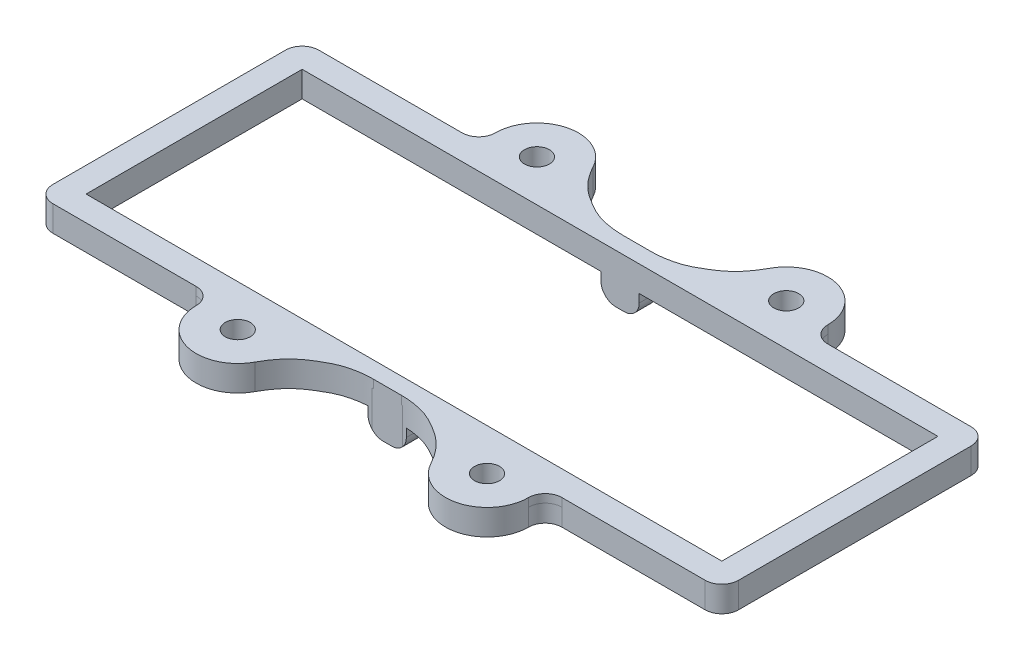
from build123d import *
from build123d.topology import SkipClean

# Parameters (mm, degrees)
SKETCH1_W           = 40
SKETCH1_H           = 7
SKETCH1_R           = 1.5
SKETCH1_W_2         = 82.5
SKETCH1_H_2         = 32
SKETCH1_W_3         = 76.5
SKETCH1_H_3         = 26
BOSS_EXTRUDE1_DEPTH = 2.085
SKETCH2_W           = 5
SKETCH2_H           = 10
BOSS_EXTRUDE2_DEPTH = 3
FILLET1_R           = 2
FILLET2_R           = 2
CUT_EXTRUDE1_DEPTH  = 65.136818612
SKETCH4_W           = 30
SKETCH4_H           = 6.817038716
CUT_EXTRUDE2_DEPTH  = 53.089568977
FILLET3_R           = 5
FILLET4_R           = 2
BOSS_EXTRUDE3_START = 1
SKETCH5_R           = 1.5
BOSS_EXTRUDE3_DEPTH = 1
FILLET5_START       = 2.085
FILLET5_DEPTH       = 1


with BuildPart() as part:
    # Sketch1 → Boss-Extrude1 (new body)
    # profile 1 of 3: a face of its own
    with BuildSketch(Plane(origin=(0, 0, 0), x_dir=(1, 0, 0), z_dir=(0, 1, 0))):
        with Locations((-3.342953498, -16.024946279)):
            Rectangle(SKETCH1_W, SKETCH1_H)
        with Locations(Location((-18.342953498, -14.524946279, 0), (0, 0, 270))):
            Circle(SKETCH1_R, mode=Mode.SUBTRACT)
        with Locations(Location((11.657046502, -14.524946279, 0), (0, 0, 270))):
            Circle(SKETCH1_R, mode=Mode.SUBTRACT)
    # profile 2 of 3: a face of its own
    with BuildSketch(Plane(origin=(0, 0, 0), x_dir=(1, 0, 0), z_dir=(0, 1, 0))):
        with Locations((-3.342953498, 3.475053721)):
            Rectangle(SKETCH1_W_2, SKETCH1_H_2)
        with Locations((-3.342953498, 3.475053721)):
            Rectangle(SKETCH1_W_3, SKETCH1_H_3, mode=Mode.SUBTRACT)
    # profile 3 of 3: a face of its own
    with BuildSketch(Plane(origin=(0, 0, 0), x_dir=(1, 0, 0), z_dir=(0, 1, 0))):
        with Locations((-3.342953498, 22.975053721)):
            Rectangle(SKETCH1_W, SKETCH1_H)
        with Locations(Location((-18.342953498, 21.475053721, 0), (0, 0, 270))):
            Circle(SKETCH1_R, mode=Mode.SUBTRACT)
        with Locations(Location((11.657046502, 21.475053721, 0), (0, 0, 270))):
            Circle(SKETCH1_R, mode=Mode.SUBTRACT)
    extrude(amount=BOSS_EXTRUDE1_DEPTH)

    # Sketch2 → Boss-Extrude2 (add)
    with BuildSketch(Plane.XZ):
        with Locations((-3.342953498, 14.524946279)):
            Rectangle(SKETCH2_W, SKETCH2_H)
        with Locations((-3.342953498, -21.475053721)):
            Rectangle(SKETCH2_W, SKETCH2_H)
    extrude(amount=BOSS_EXTRUDE2_DEPTH)

    # Fillet1
    fillet1_edges = [part.edges().sort_by_distance(p)[0] for p in [
        (-5.842953498, -3, 14.524946279),
        (-0.842953498, -3, 14.524946279),
        (-0.842953498, -3, -21.475053721),
        (-5.842953498, -3, -21.475053721),
    ]]
    fillet(fillet1_edges, radius=FILLET1_R)

    # Fillet2
    fillet2_edges = [part.edges().sort_by_distance(p)[0] for p in [
        (-44.592953498, 1.0425, 12.524946279),
        (-44.592953498, 1.0425, -19.475053721),
        (37.907046502, 1.0425, -19.475053721),
        (37.907046502, 1.0425, 12.524946279),
    ]]
    fillet(fillet2_edges, radius=FILLET2_R)

    # Sketch3 → Cut-Extrude1 (cut, through all)
    with BuildSketch(Plane(origin=(0, 0, -26.475053721), x_dir=(-1, 0, 0), z_dir=(0, 0, -1))):
        with BuildLine():
            Line((5.842953498, -1), (5.842953498, 0))
            Line((5.842953498, 0), (5.642953498, 0))
            Line((5.642953498, 0), (5.642953498, -1))
            ThreePointArc((5.642953498, -1), (5.115745704, -2.272792206), (3.842953498, -2.8))
            Line((3.842953498, -2.8), (2.842953498, -2.8))
            ThreePointArc((2.842953498, -2.8), (1.570161291, -2.272792206), (1.042953498, -1))
            Line((1.042953498, -1), (1.042953498, 0))
            Line((1.042953498, 0), (0.842953498, 0))
            Line((0.842953498, 0), (0.842953498, -1))
            ThreePointArc((0.842953498, -1), (1.428739935, -2.414213562), (2.842953498, -3))
            Line((2.842953498, -3), (3.842953498, -3))
            ThreePointArc((3.842953498, -3), (5.25716706, -2.414213562), (5.842953498, -1))
        make_face()
    extrude(amount=-CUT_EXTRUDE1_DEPTH, mode=Mode.SUBTRACT)

    # Sketch4 → Cut-Extrude2 (cut, through all)
    with BuildSketch(Plane(origin=(0, 2.085, 0), x_dir=(1, 0, 0), z_dir=(0, 1, 0))):
        with BuildLine():
            Line((-5.025587433, 18.475053721), (-3.342953498, 18.475053721))
            Line((-3.342953498, 18.475053721), (-1.660319563, 18.475053721))
            Line((-1.660319563, 18.475053721), (-1.5063675, 18.475053721))
            add(Edge.make_bspline(
                [(7.234880115, 23.808387054), (6.697838422, 22.80689338), (5.54618786, 21.222701251), (3.456402004, 19.887657692), (1.890908212, 19.048171258), (0.265447838, 18.611656881), (-0.841891354, 18.480685845), (-1.5063675, 18.475053721)],
                knots=[0, 0, 0, 0, 0.31493804, 0.524439854, 0.679221784, 0.802825172, 0.985869019, 0.985869019, 0.985869019, 0.985869019], degree=3))
            ThreePointArc((7.234880115, 23.808387054), (9.075057605, 25.756797914), (11.657046502, 26.475053721))
            Line((11.657046502, 26.475053721), (-18.342953498, 26.475053721))
            ThreePointArc((-18.342953498, 26.475053721), (-15.7609646, 25.756797914), (-13.92078711, 23.808387054))
            add(Edge.make_bspline(
                [(-13.92078711, 23.808387054), (-13.383745417, 22.80689338), (-12.232094855, 21.222701251), (-10.142308999, 19.887657692), (-8.576815207, 19.048171258), (-6.951354833, 18.611656881), (-5.844015641, 18.480685845), (-5.179539495, 18.475053721)],
                knots=[0, 0, 0, 0, 0.31493804, 0.524439854, 0.679221784, 0.802825172, 0.985869019, 0.985869019, 0.985869019, 0.985869019], degree=3))
            Line((-5.179539495, 18.475053721), (-5.025587433, 18.475053721))
        make_face()
        with Locations((-3.342953498, 29.883573079)):
            Rectangle(SKETCH4_W, SKETCH4_H)
        with BuildLine():
            ThreePointArc((-13.92078711, -16.858279612), (-15.7609646, -18.806690472), (-18.342953498, -19.524946279))
            Line((-18.342953498, -19.524946279), (11.657046502, -19.524946279))
            ThreePointArc((11.657046502, -19.524946279), (9.075057605, -18.806690472), (7.234880115, -16.858279612))
            add(Edge.make_bspline(
                [(7.234880115, -16.858279612), (6.697838422, -15.856785937), (5.54618786, -14.272593809), (3.456402004, -12.937550249), (1.890908212, -12.098063816), (0.265447838, -11.661549439), (-0.841891354, -11.530578403), (-1.5063675, -11.524946279)],
                knots=[0, 0, 0, 0, 0.31493804, 0.524439854, 0.679221784, 0.802825172, 0.985869019, 0.985869019, 0.985869019, 0.985869019], degree=3))
            Line((-1.5063675, -11.524946279), (-1.660319563, -11.524946279))
            Line((-1.660319563, -11.524946279), (-3.342953498, -11.524946279))
            Line((-3.342953498, -11.524946279), (-5.025587433, -11.524946279))
            Line((-5.025587433, -11.524946279), (-5.179539495, -11.524946279))
            add(Edge.make_bspline(
                [(-13.92078711, -16.858279612), (-13.383745417, -15.856785937), (-12.232094855, -14.272593809), (-10.142308999, -12.937550249), (-8.576815207, -12.098063816), (-6.951354833, -11.661549439), (-5.844015641, -11.530578403), (-5.179539495, -11.524946279)],
                knots=[0, 0, 0, 0, 0.31493804, 0.524439854, 0.679221784, 0.802825172, 0.985869019, 0.985869019, 0.985869019, 0.985869019], degree=3))
        make_face()
        with Locations((-3.342953498, -22.933465637)):
            Rectangle(SKETCH4_W, SKETCH4_H)
    extrude(amount=-CUT_EXTRUDE2_DEPTH, mode=Mode.SUBTRACT)

    # Fillet3
    fillet3_edges = [part.edges().sort_by_distance(p)[0] for p in [
        (16.657046502, 1.0425, -26.475053721),
        (-23.342953498, 1.0425, -26.475053721),
        (-23.342953498, 1.0425, 19.524946279),
        (16.657046502, 1.0425, 19.524946279),
    ]]
    fillet(fillet3_edges, radius=FILLET3_R - 0.0001)  # a hair under: the kernel refuses the full size

    # Fillet4
    fillet4_edges = [part.edges().sort_by_distance(p)[0] for p in [
        (-23.342953498, 1.0425, 12.524946279),
        (-23.342953498, 1.0425, -19.475053721),
        (16.657046502, 1.0425, -19.475053721),
        (16.657046502, 1.0425, 12.524946279),
    ]]
    fillet(fillet4_edges, radius=FILLET4_R)

    # Sketch5 → Boss-Extrude3 (add)
    # profile 1 of 26: a face of its own
    with SkipClean():  # the faces are left unmerged after this step: merging them gives an invalid solid
        with BuildSketch(Plane(origin=(0, 2.085, 0), x_dir=(1, 0, 0), z_dir=(0, 1, 0)).offset(BOSS_EXTRUDE3_START)):
            with BuildLine():
                ThreePointArc((-18.343003498, 26.475053721), (-21.878490939, 25.010584091), (-23.342953497, 21.475093721))
                ThreePointArc((-23.342953497, 21.475093721), (-23.237489148, 20.453525081), (-22.925529193, 19.475053721))
                Line((-22.925529193, 19.475053721), (-14.342953498, 19.475053721))
                Line((-14.342953498, 19.475053721), (-14.342953498, 24.475053721))
                ThreePointArc((-14.342953498, 24.475053721), (-16.106907881, 25.947200856), (-18.343003498, 26.475053721))
            make_face()
            with Locations((-18.342953498, 21.475053721)):
                Circle(SKETCH5_R, mode=Mode.SUBTRACT)
        # profile 2 of 26: a face of its own
        with BuildSketch(Plane(origin=(0, 2.085, 0), x_dir=(1, 0, 0), z_dir=(0, 1, 0)).offset(BOSS_EXTRUDE3_START)):
            with BuildLine():
                Line((-22.925529193, 19.475053721), (-23.342953498, 19.475053721))
                Line((-23.342953498, 19.475053721), (-23.342953498, 16.475053721))
                Line((-23.342953498, 16.475053721), (-18.342953499, 16.475053721))
                ThreePointArc((-18.342953499, 16.475053721), (-21.081566286, 17.291753589), (-22.925529193, 19.475053721))
            make_face()
        # profile 3 of 26: a face of its own
        with BuildSketch(Plane(origin=(0, 2.085, 0), x_dir=(1, 0, 0), z_dir=(0, 1, 0)).offset(BOSS_EXTRUDE3_START)):
            with BuildLine():
                Line((-23.342953498, 16.475053721), (-23.342953498, 19.475053721))
                Line((-23.342953498, 19.475053721), (-25.342953498, 19.475053721))
                Line((-25.342953498, 19.475053721), (-42.592953498, 19.475053721))
                ThreePointArc((-42.592953498, 19.475053721), (-44.00716706, 18.889267283), (-44.592953498, 17.475053721))
                Line((-44.592953498, 17.475053721), (-44.592953498, -10.524946279))
                ThreePointArc((-44.592953498, -10.524946279), (-44.00716706, -11.939159841), (-42.592953498, -12.524946279))
                Line((-42.592953498, -12.524946279), (-25.342953498, -12.524946279))
                Line((-25.342953498, -12.524946279), (-23.342953498, -12.524946279))
                Line((-23.342953498, -12.524946279), (-23.342953498, -9.524946279))
                Line((-23.342953498, -9.524946279), (-41.592953498, -9.524946279))
                Line((-41.592953498, -9.524946279), (-41.592953498, 16.475053721))
                Line((-41.592953498, 16.475053721), (-23.342953498, 16.475053721))
            make_face()
        # profile 4 of 26: a face of its own
        with BuildSketch(Plane(origin=(0, 2.085, 0), x_dir=(1, 0, 0), z_dir=(0, 1, 0)).offset(BOSS_EXTRUDE3_START)):
            with BuildLine():
                Line((-14.342953498, 19.475053721), (-22.925529193, 19.475053721))
                ThreePointArc((-22.925529193, 19.475053721), (-21.081566286, 17.291753589), (-18.342953499, 16.475053721))
                ThreePointArc((-18.342953499, 16.475053721), (-16.106885521, 17.002917766), (-14.342953498, 18.475053721))
                Line((-14.342953498, 18.475053721), (-14.342953498, 19.475053721))
            make_face()
        # profile 5 of 26: a face of its own
        with BuildSketch(Plane(origin=(0, 2.085, 0), x_dir=(1, 0, 0), z_dir=(0, 1, 0)).offset(BOSS_EXTRUDE3_START)):
            with BuildLine():
                ThreePointArc((-13.92078711, 23.808387054), (-14.118698205, 24.150061614), (-14.342953498, 24.475053721))
                Line((-14.342953498, 24.475053721), (-14.342953498, 19.475053721))
                Line((-14.342953498, 19.475053721), (-13.760377803, 19.475053721))
                ThreePointArc((-13.760377803, 19.475053721), (-13.448421933, 20.453505503), (-13.342953498, 21.475053721))
                ThreePointArc((-13.342953498, 21.475053721), (-13.489561285, 22.676962217), (-13.92078711, 23.808387054))
            make_face()
        # profile 6 of 26: a face of its own
        with BuildSketch(Plane(origin=(0, 2.085, 0), x_dir=(1, 0, 0), z_dir=(0, 1, 0)).offset(BOSS_EXTRUDE3_START)):
            with BuildLine():
                Line((-13.760377803, 19.475053721), (-14.342953498, 19.475053721))
                Line((-14.342953498, 19.475053721), (-14.342953498, 18.475053721))
                ThreePointArc((-14.342953498, 18.475053721), (-14.022635061, 18.958141206), (-13.760377803, 19.475053721))
            make_face()
        # profile 7 of 26: a face of its own
        with BuildSketch(Plane(origin=(0, 2.085, 0), x_dir=(1, 0, 0), z_dir=(0, 1, 0)).offset(BOSS_EXTRUDE3_START)):
            with BuildLine():
                ThreePointArc((-14.342953498, 18.475053721), (-16.106885521, 17.002917766), (-18.342953499, 16.475053721))
                Line((-18.342953499, 16.475053721), (11.657046523, 16.475053721))
                ThreePointArc((11.657046523, 16.475053721), (9.420978534, 17.002917762), (7.657046502, 18.475053721))
                Line((7.657046502, 18.475053721), (-1.5063675, 18.475053721))
                add(Edge.make_bspline(
                    [(-1.5063675, 18.475053721), (-1.557665042, 18.474618921), (-1.608983344, 18.47461649), (-1.660319563, 18.475053721)],
                    knots=[0.985869019, 0.985869019, 0.985869019, 0.985869019, 1, 1, 1, 1], degree=3))
                Line((-1.660319563, 18.475053721), (-3.342953498, 18.475053721))
                Line((-3.342953498, 18.475053721), (-5.025587433, 18.475053721))
                add(Edge.make_bspline(
                    [(-5.179539495, 18.475053721), (-5.128241953, 18.474618921), (-5.076923651, 18.47461649), (-5.025587433, 18.475053721)],
                    knots=[0.985869019, 0.985869019, 0.985869019, 0.985869019, 1, 1, 1, 1], degree=3))
                Line((-5.179539495, 18.475053721), (-14.342953498, 18.475053721))
            make_face()
        # profile 8 of 26: a face of its own
        with BuildSketch(Plane(origin=(0, 2.085, 0), x_dir=(1, 0, 0), z_dir=(0, 1, 0)).offset(BOSS_EXTRUDE3_START)):
            with BuildLine():
                add(Edge.make_bspline(
                    [(-13.92078711, 23.808387054), (-13.383745417, 22.80689338), (-12.232094855, 21.222701251), (-10.424029044, 20.067632367), (-9.557996846, 19.581589064), (-9.354549961, 19.475053721)],
                    knots=[0, 0, 0, 0, 0.31493804, 0.524439854, 0.587657191, 0.587657191, 0.587657191, 0.587657191], degree=3))
                ThreePointArc((-13.92078711, 23.808387054), (-13.489561285, 22.676962217), (-13.342953498, 21.475053721))
                ThreePointArc((-13.342953498, 21.475053721), (-13.448421933, 20.453505503), (-13.760377803, 19.475053721))
                Line((-13.760377803, 19.475053721), (-9.354549961, 19.475053721))
            make_face()
        # profile 9 of 26: a face of its own
        with BuildSketch(Plane(origin=(0, 2.085, 0), x_dir=(1, 0, 0), z_dir=(0, 1, 0)).offset(BOSS_EXTRUDE3_START)):
            with BuildLine():
                ThreePointArc((-13.760377803, 19.475053721), (-14.022635061, 18.958141206), (-14.342953498, 18.475053721))
                Line((-14.342953498, 18.475053721), (-5.179539495, 18.475053721))
                add(Edge.make_bspline(
                    [(-9.354549961, 19.475053721), (-9.059875559, 19.320746917), (-8.354121704, 18.98836733), (-6.951354833, 18.611656881), (-5.844015641, 18.480685845), (-5.179539495, 18.475053721)],
                    knots=[0.587657191, 0.587657191, 0.587657191, 0.587657191, 0.679221784, 0.802825172, 0.985869019, 0.985869019, 0.985869019, 0.985869019], degree=3))
                Line((-9.354549961, 19.475053721), (-13.760377803, 19.475053721))
            make_face()
        # profile 10 of 26: a face of its own
        with BuildSketch(Plane(origin=(0, 2.085, 0), x_dir=(1, 0, 0), z_dir=(0, 1, 0)).offset(BOSS_EXTRUDE3_START)):
            with BuildLine():
                ThreePointArc((16.239622197, 19.475053721), (14.395659298, 17.291753594), (11.657046523, 16.475053721))
                Line((11.657046523, 16.475053721), (16.657046502, 16.475053721))
                Line((16.657046502, 16.475053721), (16.657046502, 19.475053721))
                Line((16.657046502, 19.475053721), (16.239622197, 19.475053721))
            make_face()
        # profile 11 of 26: a face of its own
        with BuildSketch(Plane(origin=(0, 2.085, 0), x_dir=(1, 0, 0), z_dir=(0, 1, 0)).offset(BOSS_EXTRUDE3_START)):
            with BuildLine():
                ThreePointArc((7.657046502, 18.475053721), (9.420978534, 17.002917762), (11.657046523, 16.475053721))
                ThreePointArc((11.657046523, 16.475053721), (14.395659298, 17.291753594), (16.239622197, 19.475053721))
                Line((16.239622197, 19.475053721), (7.074470807, 19.475053721))
                ThreePointArc((7.074470807, 19.475053721), (7.336728066, 18.958141206), (7.657046502, 18.475053721))
            make_face()
        # profile 12 of 26: a face of its own
        with BuildSketch(Plane(origin=(0, 2.085, 0), x_dir=(1, 0, 0), z_dir=(0, 1, 0)).offset(BOSS_EXTRUDE3_START)):
            with BuildLine():
                Line((16.657046502, 19.475053721), (16.657046502, 16.475053721))
                Line((16.657046502, 16.475053721), (34.907046502, 16.475053721))
                Line((34.907046502, 16.475053721), (34.907046502, -9.524946279))
                Line((34.907046502, -9.524946279), (16.657046502, -9.524946279))
                Line((16.657046502, -9.524946279), (16.657046502, -12.524946279))
                Line((16.657046502, -12.524946279), (18.657046502, -12.524946279))
                Line((18.657046502, -12.524946279), (35.907046502, -12.524946279))
                ThreePointArc((35.907046502, -12.524946279), (37.321260065, -11.939159841), (37.907046502, -10.524946279))
                Line((37.907046502, -10.524946279), (37.907046502, 17.475053721))
                ThreePointArc((37.907046502, 17.475053721), (37.321260065, 18.889267283), (35.907046502, 19.475053721))
                Line((35.907046502, 19.475053721), (18.657046502, 19.475053721))
                Line((18.657046502, 19.475053721), (16.657046502, 19.475053721))
            make_face()
        # profile 13 of 26: a face of its own
        with BuildSketch(Plane(origin=(0, 2.085, 0), x_dir=(1, 0, 0), z_dir=(0, 1, 0)).offset(BOSS_EXTRUDE3_START)):
            with BuildLine():
                Line((-1.5063675, 18.475053721), (7.657046502, 18.475053721))
                ThreePointArc((7.657046502, 18.475053721), (7.336728066, 18.958141206), (7.074470807, 19.475053721))
                Line((7.074470807, 19.475053721), (2.668642966, 19.475053721))
                add(Edge.make_bspline(
                    [(2.668642966, 19.475053721), (2.373968563, 19.320746917), (1.668214709, 18.98836733), (0.265447838, 18.611656881), (-0.841891354, 18.480685845), (-1.5063675, 18.475053721)],
                    knots=[0.587657191, 0.587657191, 0.587657191, 0.587657191, 0.679221784, 0.802825172, 0.985869019, 0.985869019, 0.985869019, 0.985869019], degree=3))
            make_face()
        # profile 14 of 26: a face of its own
        with BuildSketch(Plane(origin=(0, 2.085, 0), x_dir=(1, 0, 0), z_dir=(0, 1, 0)).offset(BOSS_EXTRUDE3_START)):
            with BuildLine():
                Line((7.074470807, 19.475053721), (16.239622197, 19.475053721))
                ThreePointArc((16.239622197, 19.475053721), (16.551578067, 20.453505503), (16.657046502, 21.475053721))
                ThreePointArc((16.657046502, 21.475053721), (15.192598086, 25.010569949), (11.657096502, 26.475053721))
                ThreePointArc((11.657096502, 26.475053721), (9.075079014, 25.756810824), (7.234880115, 23.808387054))
                ThreePointArc((7.234880115, 23.808387054), (6.66046873, 21.660014702), (7.074470807, 19.475053721))
            make_face()
            with Locations((11.657046502, 21.475053721)):
                Circle(SKETCH5_R, mode=Mode.SUBTRACT)
        # profile 15 of 26: a face of its own
        with BuildSketch(Plane(origin=(0, 2.085, 0), x_dir=(1, 0, 0), z_dir=(0, 1, 0)).offset(BOSS_EXTRUDE3_START)):
            with BuildLine():
                Line((-18.342953493, -9.524946279), (-23.342953498, -9.524946279))
                Line((-23.342953498, -9.524946279), (-23.342953498, -12.524946279))
                Line((-23.342953498, -12.524946279), (-22.925529193, -12.524946279))
                ThreePointArc((-22.925529193, -12.524946279), (-21.081566283, -10.341646145), (-18.342953493, -9.524946279))
            make_face()
        # profile 16 of 26: a face of its own
        with BuildSketch(Plane(origin=(0, 2.085, 0), x_dir=(1, 0, 0), z_dir=(0, 1, 0)).offset(BOSS_EXTRUDE3_START)):
            with BuildLine():
                add(Edge.make_bspline(
                    [(7.234880115, 23.808387054), (6.697838422, 22.80689338), (5.54618786, 21.222701251), (3.738122049, 20.067632367), (2.872089851, 19.581589064), (2.668642966, 19.475053721)],
                    knots=[0, 0, 0, 0, 0.31493804, 0.524439854, 0.587657191, 0.587657191, 0.587657191, 0.587657191], degree=3))
                Line((2.668642966, 19.475053721), (7.074470807, 19.475053721))
                ThreePointArc((7.074470807, 19.475053721), (6.66046873, 21.660014702), (7.234880115, 23.808387054))
            make_face()
        # profile 17 of 26: a face of its own
        with BuildSketch(Plane(origin=(0, 2.085, 0), x_dir=(1, 0, 0), z_dir=(0, 1, 0)).offset(BOSS_EXTRUDE3_START)):
            with BuildLine():
                Line((11.657046502, -9.524946279), (-18.342953493, -9.524946279))
                ThreePointArc((-18.342953493, -9.524946279), (-16.106885518, -10.052810325), (-14.342953498, -11.524946279))
                Line((-14.342953498, -11.524946279), (-5.179539495, -11.524946279))
                add(Edge.make_bspline(
                    [(-5.179539495, -11.524946279), (-5.128241953, -11.524511479), (-5.076923651, -11.524509048), (-5.025587433, -11.524946279)],
                    knots=[0.985869019, 0.985869019, 0.985869019, 0.985869019, 1, 1, 1, 1], degree=3))
                Line((-5.025587433, -11.524946279), (-3.342953498, -11.524946279))
                Line((-3.342953498, -11.524946279), (-1.660319563, -11.524946279))
                add(Edge.make_bspline(
                    [(-1.5063675, -11.524946279), (-1.557665042, -11.524511479), (-1.608983344, -11.524509048), (-1.660319563, -11.524946279)],
                    knots=[0.985869019, 0.985869019, 0.985869019, 0.985869019, 1, 1, 1, 1], degree=3))
                Line((-1.5063675, -11.524946279), (7.657046502, -11.524946279))
                ThreePointArc((7.657046502, -11.524946279), (9.420978525, -10.052810324), (11.657046502, -9.524946279))
            make_face()
        # profile 18 of 26: a face of its own
        with BuildSketch(Plane(origin=(0, 2.085, 0), x_dir=(1, 0, 0), z_dir=(0, 1, 0)).offset(BOSS_EXTRUDE3_START)):
            with BuildLine():
                ThreePointArc((-14.342953498, -11.524946279), (-16.106885518, -10.052810325), (-18.342953493, -9.524946279))
                ThreePointArc((-18.342953493, -9.524946279), (-21.081566283, -10.341646145), (-22.925529193, -12.524946279))
                Line((-22.925529193, -12.524946279), (-13.760377803, -12.524946279))
                ThreePointArc((-13.760377803, -12.524946279), (-14.022635061, -12.008033764), (-14.342953498, -11.524946279))
            make_face()
        # profile 19 of 26: a face of its own
        with BuildSketch(Plane(origin=(0, 2.085, 0), x_dir=(1, 0, 0), z_dir=(0, 1, 0)).offset(BOSS_EXTRUDE3_START)):
            with BuildLine():
                Line((16.657046502, -9.524946279), (11.657046502, -9.524946279))
                ThreePointArc((11.657046502, -9.524946279), (14.39565929, -10.341646146), (16.239622197, -12.524946279))
                Line((16.239622197, -12.524946279), (16.657046502, -12.524946279))
                Line((16.657046502, -12.524946279), (16.657046502, -9.524946279))
            make_face()
        # profile 20 of 26: a face of its own
        with BuildSketch(Plane(origin=(0, 2.085, 0), x_dir=(1, 0, 0), z_dir=(0, 1, 0)).offset(BOSS_EXTRUDE3_START)):
            with BuildLine():
                ThreePointArc((16.239622197, -12.524946279), (14.39565929, -10.341646146), (11.657046502, -9.524946279))
                ThreePointArc((11.657046502, -9.524946279), (9.420978525, -10.052810324), (7.657046502, -11.524946279))
                ThreePointArc((7.657046502, -11.524946279), (7.336728066, -12.008033764), (7.074470807, -12.524946279))
                Line((7.074470807, -12.524946279), (16.239622197, -12.524946279))
            make_face()
        # profile 21 of 26: a face of its own
        with BuildSketch(Plane(origin=(0, 2.085, 0), x_dir=(1, 0, 0), z_dir=(0, 1, 0)).offset(BOSS_EXTRUDE3_START)):
            with BuildLine():
                Line((-5.179539495, -11.524946279), (-14.342953498, -11.524946279))
                ThreePointArc((-14.342953498, -11.524946279), (-14.022635061, -12.008033764), (-13.760377803, -12.524946279))
                Line((-13.760377803, -12.524946279), (-9.354549961, -12.524946279))
                add(Edge.make_bspline(
                    [(-9.354549961, -12.524946279), (-9.059875559, -12.370639475), (-8.354121704, -12.038259888), (-6.951354833, -11.661549439), (-5.844015641, -11.530578403), (-5.179539495, -11.524946279)],
                    knots=[0.587657191, 0.587657191, 0.587657191, 0.587657191, 0.679221784, 0.802825172, 0.985869019, 0.985869019, 0.985869019, 0.985869019], degree=3))
            make_face()
        # profile 22 of 26: a face of its own
        with BuildSketch(Plane(origin=(0, 2.085, 0), x_dir=(1, 0, 0), z_dir=(0, 1, 0)).offset(BOSS_EXTRUDE3_START)):
            with BuildLine():
                Line((-13.760377803, -12.524946279), (-22.925529193, -12.524946279))
                ThreePointArc((-22.925529193, -12.524946279), (-23.237489148, -13.503417639), (-23.342953497, -14.524986279))
                ThreePointArc((-23.342953497, -14.524986279), (-21.878490939, -18.060476649), (-18.343003498, -19.524946279))
                ThreePointArc((-18.343003498, -19.524946279), (-15.760986009, -18.806703382), (-13.92078711, -16.858279612))
                ThreePointArc((-13.92078711, -16.858279612), (-13.489561285, -15.726854775), (-13.342953498, -14.524946279))
                ThreePointArc((-13.342953498, -14.524946279), (-13.448421933, -13.50339806), (-13.760377803, -12.524946279))
            make_face()
            with Locations((-18.342953498, -14.524946279)):
                Circle(SKETCH5_R, mode=Mode.SUBTRACT)
        # profile 23 of 26: a face of its own
        with BuildSketch(Plane(origin=(0, 2.085, 0), x_dir=(1, 0, 0), z_dir=(0, 1, 0)).offset(BOSS_EXTRUDE3_START)):
            with BuildLine():
                ThreePointArc((16.657046502, -14.524946279), (16.551578067, -13.50339806), (16.239622197, -12.524946279))
                Line((16.239622197, -12.524946279), (7.074470807, -12.524946279))
                ThreePointArc((7.074470807, -12.524946279), (6.66046873, -14.709907259), (7.234880115, -16.858279612))
                ThreePointArc((7.234880115, -16.858279612), (9.075079014, -18.806703382), (11.657096502, -19.524946279))
                ThreePointArc((11.657096502, -19.524946279), (15.192598086, -18.060462507), (16.657046502, -14.524946279))
            make_face()
            with Locations((11.657046502, -14.524946279)):
                Circle(SKETCH5_R, mode=Mode.SUBTRACT)
        # profile 24 of 26: a face of its own
        with BuildSketch(Plane(origin=(0, 2.085, 0), x_dir=(1, 0, 0), z_dir=(0, 1, 0)).offset(BOSS_EXTRUDE3_START)):
            with BuildLine():
                ThreePointArc((7.074470807, -12.524946279), (7.336728066, -12.008033764), (7.657046502, -11.524946279))
                Line((7.657046502, -11.524946279), (-1.5063675, -11.524946279))
                add(Edge.make_bspline(
                    [(2.668642966, -12.524946279), (2.373968563, -12.370639475), (1.668214709, -12.038259888), (0.265447838, -11.661549439), (-0.841891354, -11.530578403), (-1.5063675, -11.524946279)],
                    knots=[0.587657191, 0.587657191, 0.587657191, 0.587657191, 0.679221784, 0.802825172, 0.985869019, 0.985869019, 0.985869019, 0.985869019], degree=3))
                Line((2.668642966, -12.524946279), (7.074470807, -12.524946279))
            make_face()
        # profile 25 of 26: a face of its own
        with BuildSketch(Plane(origin=(0, 2.085, 0), x_dir=(1, 0, 0), z_dir=(0, 1, 0)).offset(BOSS_EXTRUDE3_START)):
            with BuildLine():
                Line((-9.354549961, -12.524946279), (-13.760377803, -12.524946279))
                ThreePointArc((-13.760377803, -12.524946279), (-13.448421933, -13.50339806), (-13.342953498, -14.524946279))
                ThreePointArc((-13.342953498, -14.524946279), (-13.489561285, -15.726854775), (-13.92078711, -16.858279612))
                add(Edge.make_bspline(
                    [(-13.92078711, -16.858279612), (-13.383745417, -15.856785937), (-12.232094855, -14.272593809), (-10.424029044, -13.117524925), (-9.557996846, -12.631481622), (-9.354549961, -12.524946279)],
                    knots=[0, 0, 0, 0, 0.31493804, 0.524439854, 0.587657191, 0.587657191, 0.587657191, 0.587657191], degree=3))
            make_face()
        # profile 26 of 26: a face of its own
        with BuildSketch(Plane(origin=(0, 2.085, 0), x_dir=(1, 0, 0), z_dir=(0, 1, 0)).offset(BOSS_EXTRUDE3_START)):
            with BuildLine():
                ThreePointArc((7.234880115, -16.858279612), (6.66046873, -14.709907259), (7.074470807, -12.524946279))
                Line((7.074470807, -12.524946279), (2.668642966, -12.524946279))
                add(Edge.make_bspline(
                    [(7.234880115, -16.858279612), (6.697838422, -15.856785937), (5.54618786, -14.272593809), (3.738122049, -13.117524925), (2.872089851, -12.631481622), (2.668642966, -12.524946279)],
                    knots=[0, 0, 0, 0, 0.31493804, 0.524439854, 0.587657191, 0.587657191, 0.587657191, 0.587657191], degree=3))
            make_face()
        extrude(amount=-BOSS_EXTRUDE3_DEPTH)
    add(part.part.scale(1), mode=Mode.REPLACE)  # the faces are merged on a copy

    # Fillet5: read off the stored shape, not the designer's step
    # Fillet5 outline → Fillet5 (add)
    with SkipClean():  # the faces are left unmerged after this step: merging them gives an invalid solid
        with BuildSketch(Plane(origin=(0, 0, 0), x_dir=(1, 0, 0), z_dir=(0, 1, 0)).offset(FILLET5_START)):
            with BuildLine():
                ThreePointArc((16.657046502, -14.524946279), (17.24283294, -13.110732717), (18.657046502, -12.524946279))
                Line((18.657046502, -12.524946279), (16.239622197, -12.524946279))
                ThreePointArc((16.239622197, -12.524946279), (16.551578067, -13.503398061), (16.657046502, -14.524946279))
            make_face()
            with BuildLine():
                ThreePointArc((-25.342953498, -12.524946279), (-23.928739935, -13.110732716), (-23.342953498, -14.524946279))
                ThreePointArc((-23.342953498, -14.524946279), (-23.237485063, -13.503398061), (-22.925529193, -12.524946279))
                Line((-22.925529193, -12.524946279), (-25.342953498, -12.524946279))
            make_face()
            with BuildLine():
                ThreePointArc((-23.342953498, 21.475053721), (-23.928739936, 20.060840158), (-25.342953498, 19.475053721))
                Line((-25.342953498, 19.475053721), (-22.925529193, 19.475053721))
                ThreePointArc((-22.925529193, 19.475053721), (-23.237485063, 20.453505503), (-23.342953498, 21.475053721))
            make_face()
            with BuildLine():
                ThreePointArc((18.657046502, 19.475053721), (17.24283294, 20.060840159), (16.657046502, 21.475053721))
                ThreePointArc((16.657046502, 21.475053721), (16.551578067, 20.453505503), (16.239622197, 19.475053721))
                Line((16.239622197, 19.475053721), (18.657046502, 19.475053721))
            make_face()
        extrude(amount=FILLET5_DEPTH)


solid = part.part
